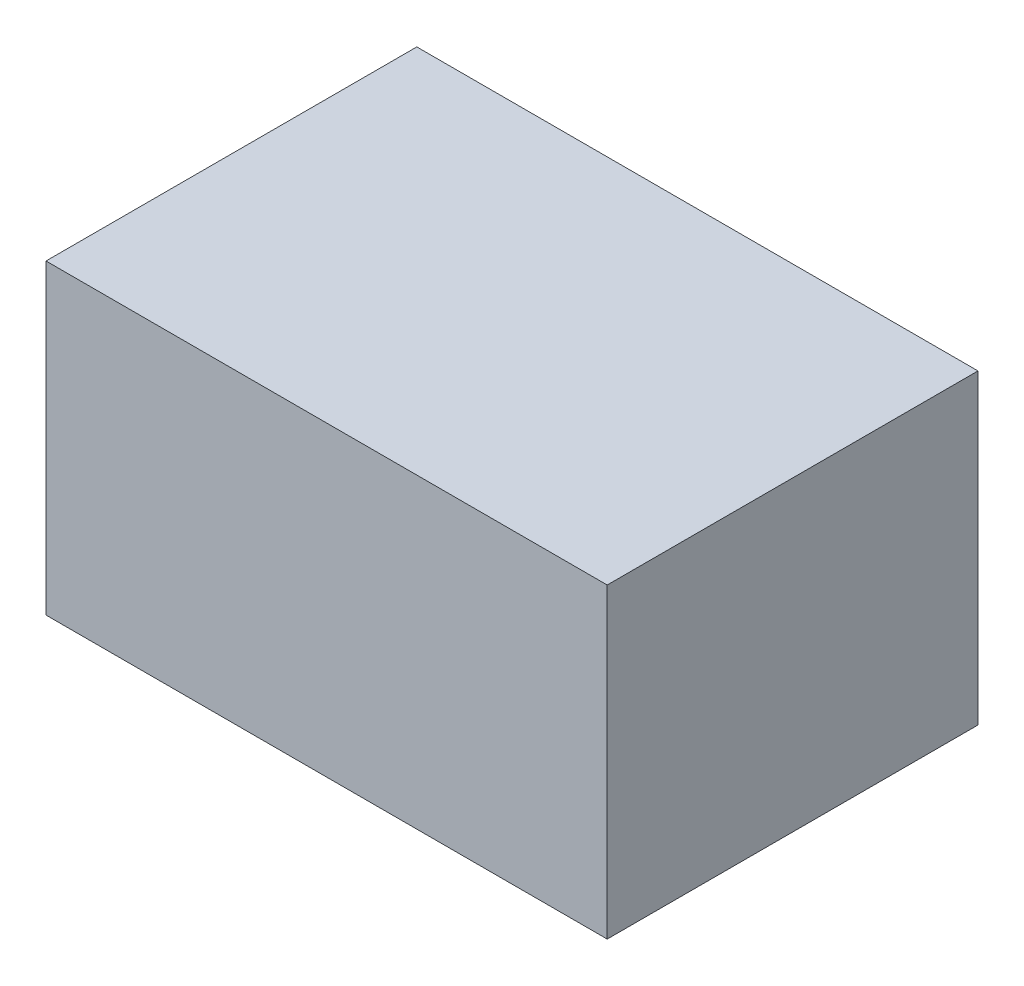
from build123d import *

# Parameters (mm, degrees)
SKETCH1_W           = 711.2
SKETCH1_H           = 469.9
BOSS_EXTRUDE1_DEPTH = 388.62


with BuildPart() as part:
    # Sketch1 → Boss-Extrude1 (new body)
    with BuildSketch(Plane(origin=(0, 0, 0), x_dir=(1, 0, 0), z_dir=(0, 1, 0))):
        Rectangle(SKETCH1_W, SKETCH1_H)
    extrude(amount=BOSS_EXTRUDE1_DEPTH)


solid = part.part
